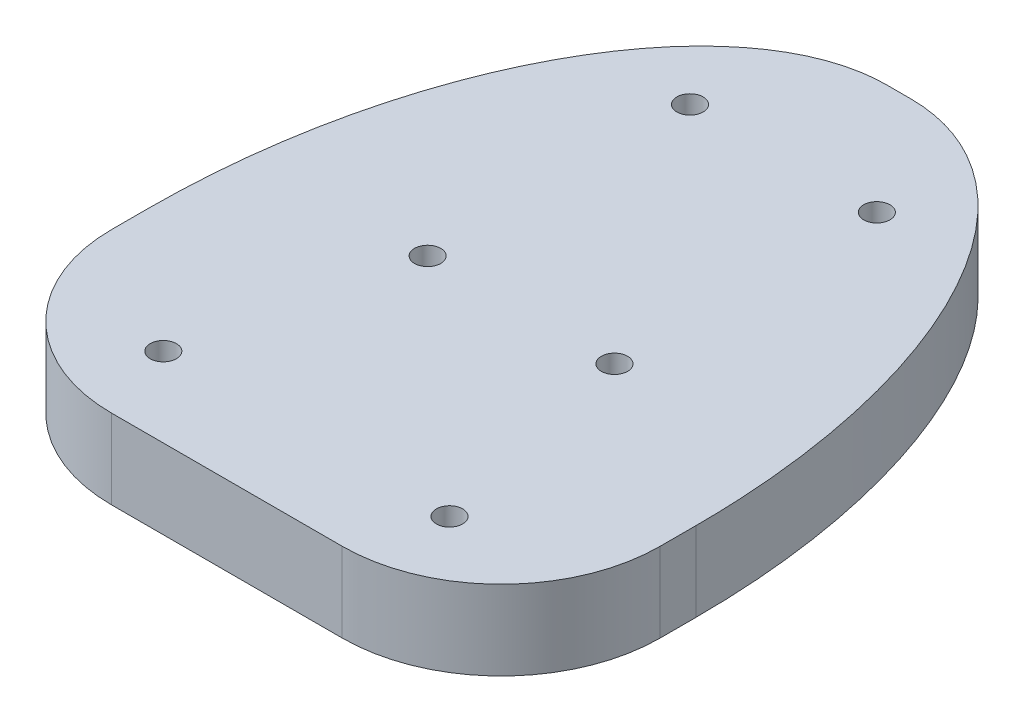
from build123d import *

# Parameters (mm, degrees)
SKETCH1_W           = 100
SKETCH1_H           = 100
BOSS_EXTRUDE1_DEPTH = 10
SKETCH2_R           = 4.005
CUT_EXTRUDE1_DEPTH  = 7
SKETCH3_R           = 1.65
CUT_EXTRUDE2_DEPTH  = 72.414284285
SKETCH4_OUTSIDE_W   = 130.354
SKETCH4_OUTSIDE_H   = 130.354
SKETCH4_OUTSIDE_W_2 = 69
SKETCH4_OUTSIDE_H_2 = 84.5
CUT_EXTRUDE3_DEPTH  = 72.414284285
FILLET1_R           = 20
FILLET2_SIZE        = 33
FILLET2_SIZE_2      = 60


with BuildPart() as part:
    # Sketch1 → Boss-Extrude1 (new body)
    with BuildSketch(Plane(origin=(0, 0, 0), x_dir=(1, 0, 0), z_dir=(0, 1, 0))):
        Rectangle(SKETCH1_W, SKETCH1_H)
    extrude(amount=BOSS_EXTRUDE1_DEPTH)

    # Sketch2 → Cut-Extrude1 (cut)
    with BuildSketch(Plane.XZ):
        with Locations(Location((-26.5, 28.5, 0), (0, 0, 270))):
            Circle(SKETCH2_R)
        with Locations(Location((26.5, 28.5, 0), (0, 0, 270))):
            Circle(SKETCH2_R)
        with Locations(Location((0, -26.5, 0), (0, 0, 270))):
            Circle(SKETCH2_R)
    extrude(amount=-CUT_EXTRUDE1_DEPTH, mode=Mode.SUBTRACT)

    # Sketch3 → Cut-Extrude2 (cut, through all)
    with BuildSketch(Plane(origin=(0, 10, 0), x_dir=(1, 0, 0), z_dir=(0, 1, 0))):
        with Locations(Location((-11.75, 20, 0), (0, 0, 270))):
            Circle(SKETCH3_R)
        with Locations(Location((11.75, 20, 0), (0, 0, 270))):
            Circle(SKETCH3_R)
        with Locations(Location((11.75, -13, 0), (0, 0, 270))):
            Circle(SKETCH3_R)
        with Locations(Location((18, -40, 0), (0, 0, 270))):
            Circle(SKETCH3_R)
        with Locations(Location((-18, -40, 0), (0, 0, 270))):
            Circle(SKETCH3_R)
        with Locations(Location((-11.75, -13, 0), (0, 0, 270))):
            Circle(SKETCH3_R)
    extrude(amount=-CUT_EXTRUDE2_DEPTH, mode=Mode.SUBTRACT)

    # Sketch4 outside → Cut-Extrude3 (cut, through all)
    with BuildSketch(Plane(origin=(0, 10, 0), x_dir=(1, 0, 0), z_dir=(0, 1, 0))):
        Rectangle(SKETCH4_OUTSIDE_W, SKETCH4_OUTSIDE_H)
        with Locations((0, -7.75)):
            Rectangle(SKETCH4_OUTSIDE_W_2, SKETCH4_OUTSIDE_H_2, mode=Mode.SUBTRACT)
    extrude(amount=-CUT_EXTRUDE3_DEPTH, mode=Mode.SUBTRACT)

    # Fillet1
    fillet1_edges = [part.edges().sort_by_distance(p)[0] for p in [
        (-34.5, 5, 50),
        (34.5, 5, 50),
    ]]
    fillet(fillet1_edges, radius=FILLET1_R)

    # Fillet2
    # an asymmetric fillet: 60, 33 mm, written as the material it takes off along each edge
    with BuildSketch(Plane(origin=(34.5, 160, -34.5), x_dir=(-1, 0, 0), z_dir=(0, -1, 0))) as fillet2_piece_1:
        with BuildLine():
            Bezier((FILLET2_SIZE, 0), (0, 0), (0, -FILLET2_SIZE_2), weights=[1, 0.707106781, 1])
            Line((0, -FILLET2_SIZE_2), (0, 0))
            Line((0, 0), (FILLET2_SIZE, 0))
        make_face()
    extrude(amount=310, mode=Mode.SUBTRACT)
    with BuildSketch(Plane(origin=(-34.5, 160, -34.5), x_dir=(0, 0, 1), z_dir=(0, -1, 0))) as fillet2_piece_2:
        with BuildLine():
            Bezier((FILLET2_SIZE_2, 0), (0, 0), (0, -FILLET2_SIZE), weights=[1, 0.707106781, 1])
            Line((0, -FILLET2_SIZE), (0, 0))
            Line((0, 0), (FILLET2_SIZE_2, 0))
        make_face()
    extrude(amount=310, mode=Mode.SUBTRACT)


solid = part.part
